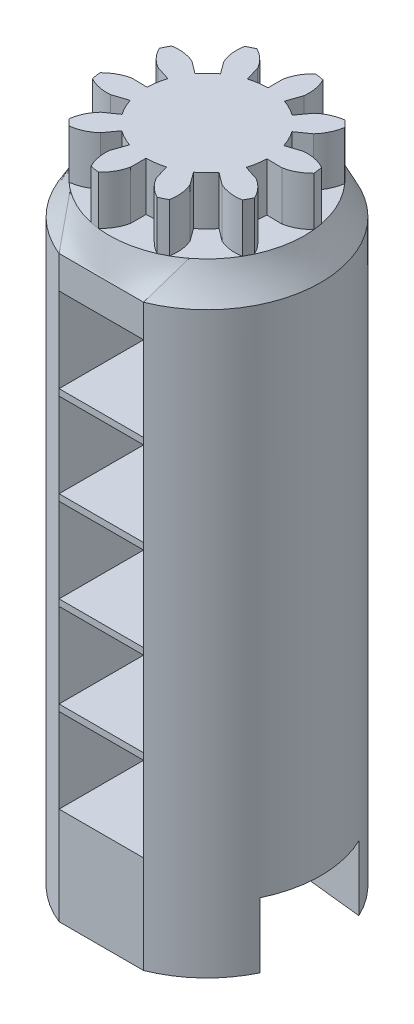
from build123d import *

# Parameters (mm, degrees)
BOSS_EXTRU_1_DEPTH           = 5.2
BOSS_EXTRU_2_START           = 0.4
BOSS_EXTRU_2_DEPTH           = 0.4
ENL_V_MAT_EXTRU_1_REACH      = 14.038
ENL_V_MAT_EXTRU_1_END_RADIUS = 7
ESQUISSE4_R                  = 2
R_P_TITION_LIN_AIRE2_COUNT   = 5
R_P_TITION_LIN_AIRE2_PITCH   = 5.6
BOSS_EXTRU_6_DEPTH           = 2
BOSS_EXTRU_7_START           = 1.6
BOSS_EXTRU_7_DEPTH           = 1.6
BOSS_EXTRU_8_START           = 4
BOSS_EXTRU_8_DEPTH           = 4
BOSS_EXTRU_10_DEPTH          = 3
ESQUISSE19_R                 = 2.5
ENL_V_MAT_EXTRU_2_DEPTH      = 5


with BuildPart() as part:
    # Esquisse1 → Boss.-Extru.1 (new body)
    with BuildSketch(Plane(origin=(0, 0, 0), x_dir=(1, 0, 0), z_dir=(0, 1, 0))):
        with BuildLine():
            Line((-2.6, -6.499230724), (-2.6, -1.299230724))
            Line((-2.6, -1.299230724), (2.6, -1.299230724))
            Line((2.6, -1.299230724), (2.6, -6.499230724))
            ThreePointArc((2.6, -6.499230724), (0, 7), (-2.6, -6.499230724))
        make_face()
    boss_extru_1 = extrude(amount=BOSS_EXTRU_1_DEPTH)

    # Esquisse3 → Boss.-Extru.2 (add)
    with BuildSketch(Plane.XZ.offset(BOSS_EXTRU_2_START)):
        with BuildLine():
            Line((-2.6, 6.499230724), (2.6, 6.499230724))
            ThreePointArc((2.6, 6.499230724), (0, -7), (-2.6, 6.499230724))
        make_face()
    boss_extru_2 = extrude(amount=-BOSS_EXTRU_2_DEPTH)

    # Enlèv. mat.-Extru.1: up to this cylinder (the profile starts inside it)
    enl_v_mat_extru_1_end = Plane(origin=(0, 2.6, 0), z_dir=(0, -1, 0)) * Cylinder(ENL_V_MAT_EXTRU_1_END_RADIUS, 43.076, mode=Mode.PRIVATE)
    # Esquisse4 → Enlèv. mat.-Extru.1 (cut, up to the surface)
    with BuildSketch(Plane.XY.offset(1.299230724), mode=Mode.PRIVATE) as enl_v_mat_extru_1_sk1:
        with Locations((0, 2.6)):
            Circle(ESQUISSE4_R)
    enl_v_mat_extru_1_tool1 = extrude(enl_v_mat_extru_1_sk1.sketch, amount=-ENL_V_MAT_EXTRU_1_REACH, mode=Mode.PRIVATE) & enl_v_mat_extru_1_end
    enl_v_mat_extru_1 = enl_v_mat_extru_1_tool1.solids().sort_by_distance((0, 2.6, 1.299231))[0]
    add(enl_v_mat_extru_1, mode=Mode.SUBTRACT)

    # Répétition linéaire2: Boss.-Extru.1, Boss.-Extru.2, Enlèv. mat.-Extru.1 ×5
    with Locations(*[(0, -i * R_P_TITION_LIN_AIRE2_PITCH, 0) for i in range(1, R_P_TITION_LIN_AIRE2_COUNT)]):
        add(boss_extru_1)
        add(boss_extru_2)
        add(enl_v_mat_extru_1, mode=Mode.SUBTRACT)

    # Esquisse9 → Boss.-Extru.6 (add)
    with BuildSketch(Plane(origin=(0, 5.2, 0), x_dir=(1, 0, 0), z_dir=(0, 1, 0))):
        with BuildLine():
            Line((-2.6, -6.499230724), (2.6, -6.499230724))
            ThreePointArc((2.6, -6.499230724), (0, 7), (-2.6, -6.499230724))
        make_face()
    extrude(amount=BOSS_EXTRU_6_DEPTH)

    # Esquisse15 → Boss.-Extru.7 (add)
    with BuildSketch(Plane(origin=(0, -22.8, 0), x_dir=(-1, 0, 0), z_dir=(0, -1, 0)).offset(BOSS_EXTRU_7_START)):
        with BuildLine():
            Line((-2.6, -6.499230724), (2.6, -6.499230724))
            ThreePointArc((2.6, -6.499230724), (0, 7), (-2.6, -6.499230724))
        make_face()
    extrude(amount=-BOSS_EXTRU_7_DEPTH)

    # Lissage2: read off the stored shape, not the designer's step
    # Lissage2: loft between two sections, ruled curve by curve
    lissage2_from = [
        Edge.make_bspline([(-3.661797611, 9.2, 4.753024117), (-9.133012873, 9.2, 0.537921798), (-6.906611615, 9.2, -6), (6.906611615, 9.2, -6), (9.133012873, 9.2, 0.537921798), (3.661797611, 9.2, 4.753024117)], [0, 0, 0, 0, 0.5, 0.5, 1, 1, 1, 1], 3, [1, 0.300565609, 0.164781682, 0.164781682, 0.300565609, 1]),
        Edge.make_bspline([(3.661797611, 9.2, 4.753024117), (3.178336157, 9.2, 5.125489721), (2.610240345, 9.2, 5.442861016), (1.361064881, 9.2, 5.880951716), (0.681073077, 9.2, 6), (-0.681073077, 9.2, 6), (-1.361064881, 9.2, 5.880951716), (-2.610240345, 9.2, 5.442861016), (-3.178336157, 9.2, 5.125489721), (-3.661797611, 9.2, 4.753024117)], [0, 0, 0, 0, 0.25, 0.25, 0.5, 0.5, 0.75, 0.75, 1, 1, 1, 1], 3),
    ]
    lissage2_to = [
        Edge.make_bspline([(-2.6, 7.2, 6.499230724), (-11.860892183, 7.2, 2.794435387), (-9.974448983, 7.2, -7), (9.974448983, 7.2, -7), (11.860892183, 7.2, 2.794435387), (2.6, 7.2, 6.499230724)], [0, 0, 0, 0, 0.5, 0.5, 1, 1, 1, 1], 3, [1, 0.211065242, 0.09696725, 0.09696725, 0.211065242, 1]),
        Edge.make_bspline([(2.6, 7.2, 6.499230724), (2.166666667, 7.2, 6.499230724), (1.733333333, 7.2, 6.499230724), (0.866666667, 7.2, 6.499230724), (0.433333333, 7.2, 6.499230724), (-0.433333333, 7.2, 6.499230724), (-0.866666667, 7.2, 6.499230724), (-1.733333333, 7.2, 6.499230724), (-2.166666667, 7.2, 6.499230724), (-2.6, 7.2, 6.499230724)], [0, 0, 0, 0, 0.25, 0.25, 0.5, 0.5, 0.75, 0.75, 1, 1, 1, 1], 3),
    ]
    lissage2 = Solid(Shell([*[Face.make_surface_from_curves(lissage2_from[k], lissage2_to[k]) for k in range(2)], Face(Wire(lissage2_from)), Face(Wire(lissage2_to))]))
    add(lissage2)

    # Esquisse16 → Boss.-Extru.8 (add)
    with BuildSketch(Plane.XZ.offset(24.4).offset(BOSS_EXTRU_8_START)):
        with BuildLine():
            Line((6.304444788, -3.042034832), (0.396428571, -3.678701454))
            ThreePointArc((0.396428571, -3.678701454), (0, -3.7), (-0.396428571, -3.678701454))
            Line((-0.396428571, -3.678701454), (-6.304444788, -3.042034832))
            ThreePointArc((-6.304444788, -3.042034832), (0, -7), (6.304444788, -3.042034832))
        make_face()
        with BuildLine():
            Line((-6.304444788, 3.042034832), (-0.396428571, 3.678701454))
            ThreePointArc((-0.396428571, 3.678701454), (0, 3.7), (0.396428571, 3.678701454))
            Line((0.396428571, 3.678701454), (6.304444788, 3.042034832))
            ThreePointArc((6.304444788, 3.042034832), (4.776016656, 5.117583893), (2.6, 6.499230724))
            Line((2.6, 6.499230724), (-2.6, 6.499230724))
            ThreePointArc((-2.6, 6.499230724), (-4.776016656, 5.117583893), (-6.304444788, 3.042034832))
        make_face()
    extrude(amount=-BOSS_EXTRU_8_DEPTH)

    # Esquisse18 → Boss.-Extru.10 (add)
    with BuildSketch(Plane(origin=(0, 9.2, 0), x_dir=(1, 0, 0), z_dir=(0, 1, 0))):
        with BuildLine():
            Line((0, 4.698463104), (0, 3.75))
            ThreePointArc((0, 3.75), (-0.554703415, 3.708746975), (-1.09720246, 3.585895531))
            Line((-1.09720246, 3.585895531), (-1.37471074, 4.49285276))
            ThreePointArc((-1.37471074, 4.49285276), (-1.824554792, 5.070002), (-2.425132729, 5.488053503))
            ThreePointArc((-2.425132729, 5.488053503), (-2.677792224, 5.369304313), (-2.924654435, 5.238930849))
            ThreePointArc((-2.924654435, 5.238930849), (-2.952055608, 4.50769211), (-2.761687321, 3.801136499))
            Line((-2.761687321, 3.801136499), (-2.204194696, 3.033813729))
            ThreePointArc((-2.204194696, 3.033813729), (-2.628711266, 2.674392844), (-2.995391946, 2.256131001))
            Line((-2.995391946, 2.256131001), (-3.752996944, 2.826759537))
            ThreePointArc((-3.752996944, 2.826759537), (-4.456168239, 3.029271381), (-5.187770504, 3.014471297))
            ThreePointArc((-5.187770504, 3.014471297), (-5.322377307, 2.769891659), (-5.445461431, 2.519315344))
            ThreePointArc((-5.445461431, 2.519315344), (-5.037818099, 1.911624773), (-4.468503952, 1.451904947))
            Line((-4.468503952, 1.451904947), (-3.566461936, 1.158813729))
            ThreePointArc((-3.566461936, 1.158813729), (-3.69864076, 0.618511546), (-3.749443518, 0.06460111))
            Line((-3.749443518, 0.06460111), (-4.697765875, 0.080940249))
            ThreePointArc((-4.697765875, 0.080940249), (-5.385676878, -0.168537945), (-5.968856272, -0.610536486))
            ThreePointArc((-5.968856272, -0.610536486), (-5.933995159, -0.887525464), (-5.886287245, -1.162592994))
            ThreePointArc((-5.886287245, -1.162592994), (-5.199305306, -1.414618255), (-4.468503952, -1.451904947))
            Line((-4.468503952, -1.451904947), (-3.566461936, -1.158813729))
            ThreePointArc((-3.566461936, -1.158813729), (-3.355815195, -1.67362014), (-3.071335106, -2.151604208))
            Line((-3.071335106, -2.151604208), (-3.848147913, -2.695795463))
            ThreePointArc((-3.848147913, -2.695795463), (-4.258040002, -3.301971504), (-4.470041819, -4.002340083))
            ThreePointArc((-4.470041819, -4.002340083), (-4.27902855, -4.205938025), (-4.078751399, -4.400430323))
            ThreePointArc((-4.078751399, -4.400430323), (-3.374834604, -4.200525189), (-2.761687321, -3.801136499))
            Line((-2.761687321, -3.801136499), (-2.204194696, -3.033813729))
            ThreePointArc((-2.204194696, -3.033813729), (-1.731182287, -3.326485817), (-1.220081074, -3.54596985))
            Line((-1.220081074, -3.54596985), (-1.528668242, -4.442828935))
            ThreePointArc((-1.528668242, -4.442828935), (-1.503976571, -5.174164178), (-1.263823322, -5.865385802))
            ThreePointArc((-1.263823322, -5.865385802), (-0.989618473, -5.917825215), (-0.71327115, -5.957452834))
            ThreePointArc((-0.71327115, -5.957452834), (-0.261291789, -5.381974273), (0, -4.698463104))
            Line((0, -4.698463104), (0, -3.75))
            ThreePointArc((0, -3.75), (0.554703415, -3.708746975), (1.09720246, -3.585895531))
            Line((1.09720246, -3.585895531), (1.37471074, -4.49285276))
            ThreePointArc((1.37471074, -4.49285276), (1.824554792, -5.070002), (2.425132729, -5.488053503))
            ThreePointArc((2.425132729, -5.488053503), (2.677792224, -5.369304313), (2.924654435, -5.238930849))
            ThreePointArc((2.924654435, -5.238930849), (2.952055608, -4.50769211), (2.761687321, -3.801136499))
            Line((2.761687321, -3.801136499), (2.204194696, -3.033813729))
            ThreePointArc((2.204194696, -3.033813729), (2.628711266, -2.674392844), (2.995391946, -2.256131001))
            Line((2.995391946, -2.256131001), (3.752996944, -2.826759537))
            ThreePointArc((3.752996944, -2.826759537), (4.456168239, -3.029271381), (5.187770504, -3.014471297))
            ThreePointArc((5.187770504, -3.014471297), (5.322377307, -2.769891659), (5.445461431, -2.519315344))
            ThreePointArc((5.445461431, -2.519315344), (5.037818099, -1.911624773), (4.468503952, -1.451904947))
            Line((4.468503952, -1.451904947), (3.566461936, -1.158813729))
            ThreePointArc((3.566461936, -1.158813729), (3.69864076, -0.618511546), (3.749443518, -0.06460111))
            Line((3.749443518, -0.06460111), (4.697765875, -0.080940249))
            ThreePointArc((4.697765875, -0.080940249), (5.385676878, 0.168537945), (5.968856272, 0.610536486))
            ThreePointArc((5.968856272, 0.610536486), (5.933995159, 0.887525464), (5.886287245, 1.162592994))
            ThreePointArc((5.886287245, 1.162592994), (5.199305306, 1.414618255), (4.468503952, 1.451904947))
            Line((4.468503952, 1.451904947), (3.566461936, 1.158813729))
            ThreePointArc((3.566461936, 1.158813729), (3.355815195, 1.67362014), (3.071335106, 2.151604208))
            Line((3.071335106, 2.151604208), (3.848147913, 2.695795463))
            ThreePointArc((3.848147913, 2.695795463), (4.258040002, 3.301971504), (4.470041819, 4.002340083))
            ThreePointArc((4.470041819, 4.002340083), (4.27902855, 4.205938025), (4.078751399, 4.400430323))
            ThreePointArc((4.078751399, 4.400430323), (3.374834604, 4.200525189), (2.761687321, 3.801136499))
            Line((2.761687321, 3.801136499), (2.204194696, 3.033813729))
            ThreePointArc((2.204194696, 3.033813729), (1.731182287, 3.326485817), (1.220081074, 3.54596985))
            Line((1.220081074, 3.54596985), (1.528668242, 4.442828935))
            ThreePointArc((1.528668242, 4.442828935), (1.503976571, 5.174164178), (1.263823322, 5.865385802))
            ThreePointArc((1.263823322, 5.865385802), (0.989618473, 5.917825215), (0.71327115, 5.957452834))
            ThreePointArc((0.71327115, 5.957452834), (0.261291789, 5.381974273), (0, 4.698463104))
        make_face()
    extrude(amount=BOSS_EXTRU_10_DEPTH)

    # Esquisse19 → Enlèv. mat.-Extru.2 (cut)
    with BuildSketch(Plane.XZ.offset(28.4)):
        with Locations(Location((0, 0, 0), (0, 0, 270))):
            Circle(ESQUISSE19_R)
    extrude(amount=-ENL_V_MAT_EXTRU_2_DEPTH, mode=Mode.SUBTRACT)


solid = part.part
